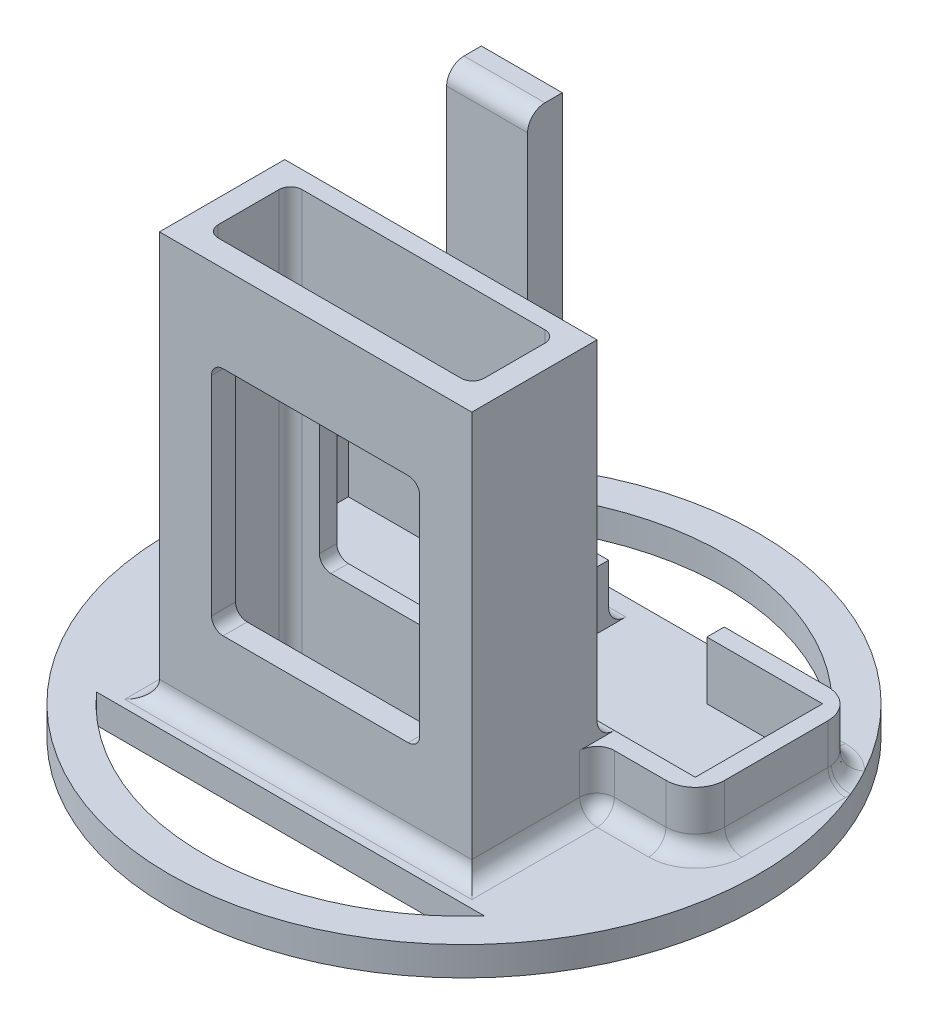
from build123d import *

# Parameters (mm, degrees)
SKETCH1_R           = 25.5
SKETCH1_R_2         = 22.5
SKETCH1_W           = 33.541019662
SKETCH1_H           = 30
BOSS_EXTRUDE1_DEPTH = 2.5
SKETCH2_W           = 1.5
SKETCH2_H           = 1.5
SKETCH2_W_2         = 41
BOSS_EXTRUDE2_DEPTH = 5
FILLET1_R           = 2.54
SKETCH3_W           = 10
SKETCH3_H           = 1.5
CUT_EXTRUDE1_DEPTH  = 5
SKETCH4_W           = 7
SKETCH4_H           = 3
BOSS_EXTRUDE3_DEPTH = 35
FILLET2_R           = 1.5
FILLET3_R           = 1.5
SKETCH5_W           = 11.5
SKETCH5_H           = 0.25
SKETCH5_H_2         = 1.25
SKETCH5_W_2         = 2
SKETCH5_H_3         = 7.25
BOSS_EXTRUDE5_DEPTH = 35
FILLET4_R           = 1.5
FILLET5_R           = 1.5
FILLET6_R           = 1
SKETCH6_W           = 9
SKETCH6_H           = 10
CUT_EXTRUDE3_DEPTH  = 19.76
FILLET7_R           = 1


with BuildPart() as part:
    # Sketch1 → Boss-Extrude1 (new body)
    # profile 1 of 4: a face of its own
    with BuildSketch(Plane(origin=(0, 0, 0), x_dir=(1, 0, 0), z_dir=(0, 1, 0))):
        with Locations(Location((0, 0, 0), (0, 0, 270))):
            Circle(SKETCH1_R)
        Circle(SKETCH1_R_2, mode=Mode.SUBTRACT)
    # profile 2 of 4: a face of its own
    with BuildSketch(Plane(origin=(0, 0, 0), x_dir=(1, 0, 0), z_dir=(0, 1, 0))):
        Rectangle(SKETCH1_W, SKETCH1_H)
    # profile 3 of 4: a face of its own
    with BuildSketch(Plane(origin=(0, 0, 0), x_dir=(1, 0, 0), z_dir=(0, 1, 0))):
        with BuildLine():
            ThreePointArc((22.5, 0), (21.018878077, 8.02849702), (16.770509831, 15))
            Line((16.770509831, 15), (16.770509831, -15))
            ThreePointArc((16.770509831, -15), (21.018878077, -8.02849702), (22.5, 0))
        make_face()
    # profile 4 of 4: a face of its own
    with BuildSketch(Plane(origin=(0, 0, 0), x_dir=(1, 0, 0), z_dir=(0, 1, 0))):
        with BuildLine():
            Line((-16.770509831, -15), (-16.770509831, 15))
            ThreePointArc((-16.770509831, 15), (-22.5, 0), (-16.770509831, -15))
        make_face()
    extrude(amount=BOSS_EXTRUDE1_DEPTH)

    # Sketch2 → Boss-Extrude2 (add)
    with BuildSketch(Plane(origin=(0, 2.5, 0), x_dir=(1, 0, 0), z_dir=(0, 1, 0))):
        Polygon((-20.5, -0.5), (-20.5, 5.5), (-20.5, 10.5), (-22, 10.5), (-22, -0.5), align=None)
        with Locations((-21.25, -1.25)):
            Rectangle(SKETCH2_W, SKETCH2_H)
        with Locations((0, -1.25)):
            Rectangle(SKETCH2_W_2, SKETCH2_H)
        Polygon((20.5, 10.5), (20.5, 5.5), (20.5, -0.5), (20.5, -2), (22, -2), (22, 12), (20.5, 12), align=None)
        Polygon((-20.5, 10.5), (20.5, 10.5), (20.5, 12), (-22, 12), (-22, 10.5), align=None)
    extrude(amount=BOSS_EXTRUDE2_DEPTH)

    # Fillet1
    fillet1_edges = [part.edges().sort_by_distance(p)[0] for p in [
        (-22, 5, -12),
        (-22, 5, 2),
        (22, 5, 2),
        (22, 5, -12),
    ]]
    fillet(fillet1_edges, radius=FILLET1_R)

    # Sketch3 → Cut-Extrude1 (cut)
    with BuildSketch(Plane(origin=(0, 7.5, 0), x_dir=(1, 0, 0), z_dir=(0, 1, 0))):
        with Locations((5.5, 11.25)):
            Rectangle(SKETCH3_W, SKETCH3_H)
    extrude(amount=-CUT_EXTRUDE1_DEPTH, mode=Mode.SUBTRACT)

    # Sketch4 → Boss-Extrude3 (add)
    with BuildSketch(Plane(origin=(0, 2.5, 0), x_dir=(1, 0, 0), z_dir=(0, 1, 0))):
        with Locations((-10, 13.5)):
            Rectangle(SKETCH4_W, SKETCH4_H)
    extrude(amount=BOSS_EXTRUDE3_DEPTH)

    # Fillet2
    fillet2_edges = [part.edges().sort_by_distance(p)[0] for p in [
        (-10, 7.5, -12),
        (-3, 2.5, -12),
        (-6.5, 2.5, -13.5),
        (-13.5, 2.5, -13.5),
        (0, 2.5, 2),
        (-22, 2.5, -5),
        (22, 2.5, -5),
        (-16.48, 2.5, -12),
        (-21.256051224, 2.5, 1.256051224),
        (21.256051224, 2.5, 1.256051224),
        (21.256051224, 2.5, -11.256051224),
        (-21.256051224, 2.5, -11.256051224),
        (14.98, 2.5, -12),
    ]]
    fillet(fillet2_edges, radius=FILLET2_R - 0.0001)  # a hair under: the kernel refuses the full size

    # Fillet3
    fillet3_edges = [part.edges().sort_by_distance(p)[0] for p in [
        (-10, 37.5, -12),
    ]]
    fillet(fillet3_edges, radius=FILLET3_R)

    # Sketch5 → Boss-Extrude5 (add)
    with BuildSketch(Plane(origin=(0, 2.5, 0), x_dir=(1, 0, 0), z_dir=(0, 1, 0))):
        with Locations((-5.75, -2.125)):
            Rectangle(SKETCH5_W, SKETCH5_H)
        with Locations((-5.75, -2.875)):
            Rectangle(SKETCH5_W, SKETCH5_H_2)
        with Locations((5.75, -2.875)):
            Rectangle(SKETCH5_W, SKETCH5_H_2)
        with Locations((5.75, -2.125)):
            Rectangle(SKETCH5_W, SKETCH5_H)
        Polygon((13.5, -2), (11.5, -2), (11.5, -2.25), (11.5, -3.5), (13.5, -3.5), align=None)
        with Locations((12.5, -7.125)):
            Rectangle(SKETCH5_W_2, SKETCH5_H_3)
        Polygon((11.5, -10.75), (-11.5, -10.75), (-13.5, -10.75), (-13.5, -12.825519341), (13.5, -12.825519341), (13.5, -10.75), align=None)
        with Locations((-12.5, -7.125)):
            Rectangle(SKETCH5_W_2, SKETCH5_H_3)
        Polygon((-11.5, -2.25), (-11.5, -2), (-13.5, -2), (-13.5, -3.5), (-11.5, -3.5), align=None)
    extrude(amount=BOSS_EXTRUDE5_DEPTH)

    # Fillet4
    fillet4_edges = [part.edges().sort_by_distance(p)[0] for p in [
        (0, 7.5, 2),
    ]]
    fillet(fillet4_edges, radius=FILLET4_R - 0.0001)  # a hair under: the kernel refuses the full size

    # Fillet5
    fillet5_edges = [part.edges().sort_by_distance(p)[0] for p in [
        (-13.5, 2.939310539, 2.439310539),
        (13.5, 2.939310539, 2.439310539),
        (13.5, 2.5, 8.16270967),
        (13.5, 5.74995, 2),
        (-13.5, 5.74995, 2),
        (0, 2.5, 12.825519341),
        (-13.5, 2.5, 8.16270967),
    ]]
    fillet(fillet5_edges, radius=FILLET5_R - 0.0001)  # a hair under: the kernel refuses the full size

    # Fillet6
    fillet6_edges = [part.edges().sort_by_distance(p)[0] for p in [
        (11.5, 20, 3.5),
        (11.5, 20, 10.75),
        (-11.5, 20, 10.75),
        (-11.5, 20, 3.5),
    ]]
    fillet(fillet6_edges, radius=FILLET6_R)

    # Sketch6 → Cut-Extrude3 (cut)
    with BuildSketch(Plane.XY.offset(12.825519341)):
        with Locations((-4.5, 25)):
            Rectangle(SKETCH6_W, SKETCH6_H)
        Polygon((9, 30), (0, 30), (0, 20), (-9, 20), (-9, 10), (9, 10), align=None)
    extrude(amount=-CUT_EXTRUDE3_DEPTH, mode=Mode.SUBTRACT)

    # Fillet7
    fillet7_edges = [part.edges().sort_by_distance(p)[0] for p in [
        (-9, 30, 11.78775967),
        (9, 30, 11.78775967),
        (9, 10, 11.78775967),
        (-9, 10, 11.78775967),
        (-9, 30, 2.75),
        (9, 30, 2.75),
        (9, 10, 2.75),
        (-9, 10, 2.75),
    ]]
    fillet(fillet7_edges, radius=FILLET7_R)


solid = part.part
